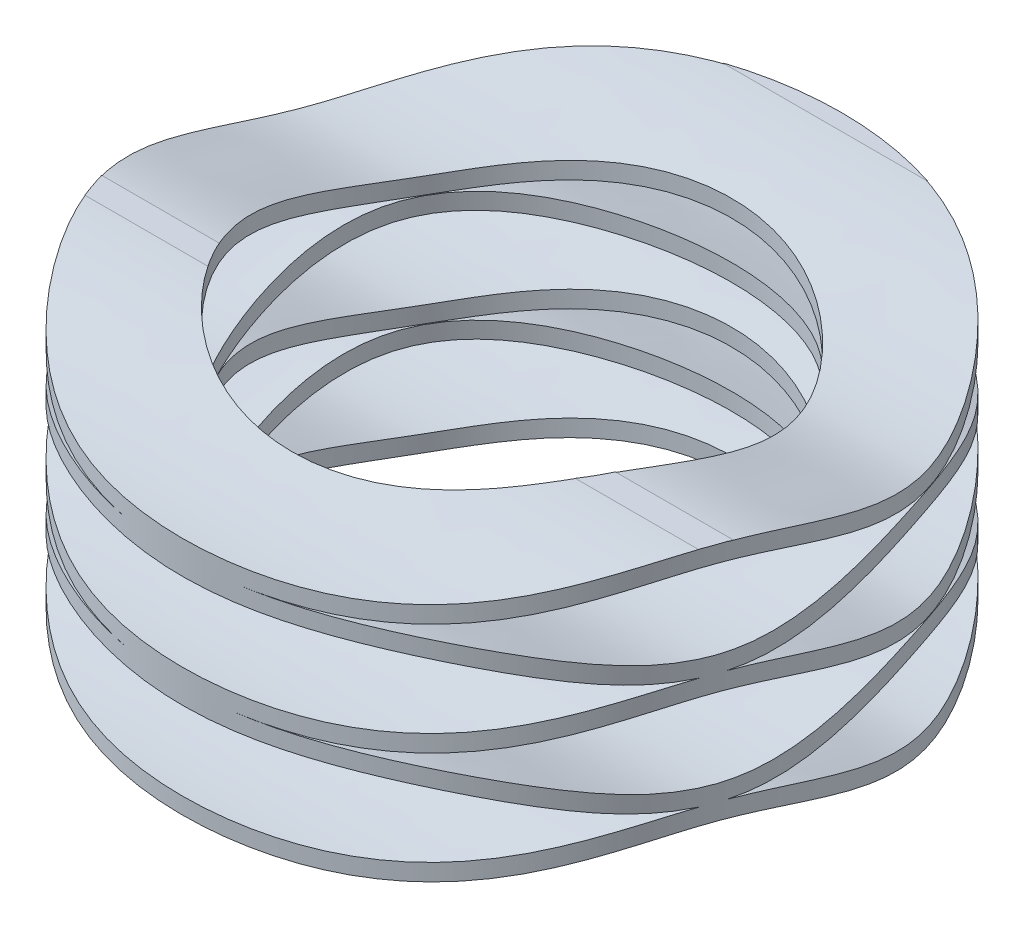
from build123d import *

# Parameters (mm, degrees)
EXTRUDE_THIN1_START       = -4.5
EXTRUDE_THIN1_DEPTH       = 9
BOSS_EXTRUDE2_DEPTH       = 4.5
LPATTERN3_COUNT           = 3
LPATTERN3_PITCH           = 1.016
BOSS_EXTRUDE1_START       = -0.254
BOSS_EXTRUDE1_OUTLINE_W   = 3.81
BOSS_EXTRUDE1_OUTLINE_H   = 0.866
BOSS_EXTRUDE1_OUTLINE_H_2 = 1.628
BOSS_EXTRUDE1_DEPTH       = 0.254
CUT_EXTRUDE1_DEPTH        = 9.775881847
CUT_EXTRUDE1_DEPTH_BACK   = 9.775881847
SKETCH8_OUTSIDE_W         = 13.404
SKETCH8_OUTSIDE_H         = 11.404
SKETCH8_OUTSIDE_R         = 3
SKETCH8_OUTSIDE_R_2       = 2
CUT_EXTRUDE2_DEPTH        = 8.368280209
CUT_EXTRUDE2_DEPTH_BACK   = 8.368280209
SKETCH12_W                = 6.3
SKETCH12_H                = 0.5334


# Read off the part's stored shape, not the designer's step: Extrude-Thin1, Boss-Extrude1
with BuildPart() as part:
    # Extrude-Thin1 outline → Extrude-Thin1 (new body)
    with BuildSketch(Plane(origin=(0, 0, 0), x_dir=(0, 0, -1), z_dir=(1, 0, 0)).offset(EXTRUDE_THIN1_START)):
        with BuildLine():
            Line((6, 0.358749908), (6.5, 0.35875))
            Line((6.5, 0.35875), (6.5, 0.50875))
            Line((6.5, 0.50875), (6, 0.508750088))
            add(Edge.make_bspline(
                [(0, 0.150000088), (0.031256434, 0.149952215), (0.060039338, 0.1506653), (0.120258518, 0.153482182), (0.210774869, 0.159793298), (0.301870259, 0.171771792), (0.484815646, 0.20166417), (0.607780886, 0.229521443), (0.979316509, 0.323290782), (1.230363015, 0.399547253), (1.612489844, 0.476846175), (1.740843897, 0.496393481), (1.999634311, 0.512744705), (2.13003964, 0.50795508), (2.516161744, 0.462340449), (2.769445647, 0.393700912), (3.269397412, 0.25918261), (3.516107597, 0.193284914), (3.880057677, 0.150604018), (3.999698806, 0.146285293), (4.240982009, 0.161481393), (4.362654322, 0.179783398), (4.73057954, 0.253860956), (4.979536239, 0.328958098), (5.357960046, 0.424353367), (5.484972695, 0.453240499), (5.676978502, 0.484817268), (5.741229378, 0.493380173), (5.837988591, 0.502319308), (5.870305256, 0.504647857), (5.935063165, 0.507839362), (5.96875404, 0.508702208), (6, 0.508750088)],
                knots=[0, 0, 0, 0, 0.015625, 0.015625, 0.03125, 0.0625, 0.0625, 0.125, 0.125, 0.25, 0.25, 0.3125, 0.3125, 0.375, 0.375, 0.5, 0.5, 0.625, 0.625, 0.6875, 0.6875, 0.75, 0.75, 0.875, 0.875, 0.9375, 0.9375, 0.96875, 0.96875, 0.984375, 0.984375, 1, 1, 1, 1], degree=3))
            Line((0, 0.150000088), (-0.5, 0.15))
            Line((-0.5, 0.15), (-0.5, 0))
            Line((-0.5, 0), (0, -8.5e-08))
            add(Edge.make_bspline(
                [(0, -8.5e-08), (0.520356507, -0.000765997), (1.024536721, 0.204887838), (1.637569436, 0.328877577), (1.759194149, 0.347258439), (2.000358563, 0.362486712), (2.119929768, 0.35810893), (2.483741291, 0.315122203), (2.730419434, 0.248866673), (3.230467546, 0.114322442), (3.483795198, 0.046052763), (3.869911313, 0.000762751), (4.000293595, -0.003968915), (4.259055637, 0.012316959), (4.387404594, 0.03176059), (5.024285288, 0.159968798), (5.520163994, 0.357983884), (6, 0.358749908)],
                knots=[0, 0, 0, 0, 0.25, 0.25, 0.3125, 0.3125, 0.375, 0.375, 0.5, 0.5, 0.625, 0.625, 0.6875, 0.6875, 0.75, 0.75, 1, 1, 1, 1], degree=3))
        make_face()
    extrude(amount=EXTRUDE_THIN1_DEPTH)

    # Sketch10 → Boss-Extrude2 (add, symmetric)
    with BuildSketch(Plane(origin=(0, 0, 0), x_dir=(0, 0, -1), z_dir=(1, 0, 0))):
        with BuildLine():
            Line((1.33e-07, 0.865991275), (-0.5, 0.866))
            Line((-0.5, 0.866), (-0.5, 1.016))
            Line((-0.5, 1.016), (-1.22e-07, 1.016008363))
            add(Edge.make_bspline(
                [(-1.22e-07, 1.016008363), (0.259517186, 1.019803052), (0.774419992, 0.916164213), (1.521761287, 0.676043554), (2.236778035, 0.621914182), (2.97558555, 0.834469531), (3.737620423, 1.045020519), (4.518737287, 0.988205571), (5.274783047, 0.75434406), (5.75299849, 0.654448607), (6.000000146, 0.650509166)],
                knots=[0.000182426, 0.000182426, 0.000182426, 0.000182426, 0.125134666, 0.250086906, 0.375039146, 0.499991386, 0.624943626, 0.749895866, 0.874848106, 0.999800346, 0.999800346, 0.999800346, 0.999800346], degree=3))
            Line((6.000000146, 0.650509166), (6.5, 0.6505))
            Line((6.5, 0.6505), (6.5, 0.5005))
            Line((6.5, 0.5005), (5.999999865, 0.50049119))
            add(Edge.make_bspline(
                [(1.33e-07, 0.865991275), (0.246335707, 0.869749199), (0.724862734, 0.774095043), (1.47978044, 0.529582452), (2.262475926, 0.470473471), (3.022637948, 0.693174988), (3.761991622, 0.893754963), (4.481355175, 0.840956011), (5.229934073, 0.610779744), (5.741136513, 0.504459447), (5.999999865, 0.50049119)],
                knots=[-0.000190322, -0.000190322, -0.000190322, -0.000190322, 0.124857456, 0.249905234, 0.374953012, 0.50000079, 0.625048568, 0.750096346, 0.875144124, 1.000191902, 1.000191902, 1.000191902, 1.000191902], degree=3))
        make_face()
    extrude(amount=BOSS_EXTRUDE2_DEPTH, both=True)


with BuildPart() as lpattern3_1:
    # LPattern3: pattern copy
    add(part.part.moved(Location(Vector(0, 1, 0) * (1 * LPATTERN3_PITCH))))


with BuildPart() as lpattern3_2:
    # LPattern3: pattern copy
    add(part.part.moved(Location(Vector(0, 1, 0) * (2 * LPATTERN3_PITCH))))


with BuildPart() as boss_extrude1_tool:
    # Boss-Extrude1 outline → Boss-Extrude1 (new body)
    with BuildSketch(Plane.XY.offset(0.5).offset(BOSS_EXTRUDE1_START)):
        with Locations((0, 0.583)):
            Rectangle(BOSS_EXTRUDE1_OUTLINE_W, BOSS_EXTRUDE1_OUTLINE_H)
        with Locations((0, 1.599)):
            Rectangle(BOSS_EXTRUDE1_OUTLINE_W, BOSS_EXTRUDE1_OUTLINE_H)
        with Locations((0, 2.996)):
            Rectangle(BOSS_EXTRUDE1_OUTLINE_W, BOSS_EXTRUDE1_OUTLINE_H_2)
    extrude(amount=BOSS_EXTRUDE1_DEPTH)


with BuildPart() as part_1:
    add(part.part)


with BuildPart() as part_2:
    # Boss-Extrude1: joined with boss_extrude1_tool
    add(part_1.part.fuse(boss_extrude1_tool.part, lpattern3_1.part, lpattern3_2.part, tol=0.00001))

    # Sketch8 outside → Cut-Extrude1 (cut, two sides: drawn at the far end of the back side and taken through both)
    # profile 1 of 2: a face of its own
    with BuildSketch(Plane(origin=(0, 0, 0), x_dir=(1, 0, 0), z_dir=(0, 1, 0)).offset(-CUT_EXTRUDE1_DEPTH_BACK)):
        with Locations((0, 3)):
            Rectangle(SKETCH8_OUTSIDE_W, SKETCH8_OUTSIDE_H)
        with Locations(Location((0, 3, 0), (0, 0, 270))):
            Circle(SKETCH8_OUTSIDE_R, mode=Mode.SUBTRACT)
    # profile 2 of 2: a face of its own
    with BuildSketch(Plane(origin=(0, 0, 0), x_dir=(1, 0, 0), z_dir=(0, 1, 0)).offset(-CUT_EXTRUDE1_DEPTH_BACK)):
        with Locations(Location((0, 3, 0), (0, 0, 270))):
            Circle(SKETCH8_OUTSIDE_R_2)
    extrude(amount=CUT_EXTRUDE1_DEPTH + CUT_EXTRUDE1_DEPTH_BACK, mode=Mode.SUBTRACT)

    # Sketch12 → Cut-Extrude2 (cut, two sides: drawn at the far end of the back side and taken through both)
    with BuildSketch(Plane(origin=(0, 0, 0), x_dir=(0, 0, -1), z_dir=(1, 0, 0)).offset(-CUT_EXTRUDE2_DEPTH_BACK)):
        with Locations((3, 2.8067)):
            Rectangle(SKETCH12_W, SKETCH12_H)
    extrude(amount=CUT_EXTRUDE2_DEPTH + CUT_EXTRUDE2_DEPTH_BACK, mode=Mode.SUBTRACT)


solid = part_2.part
